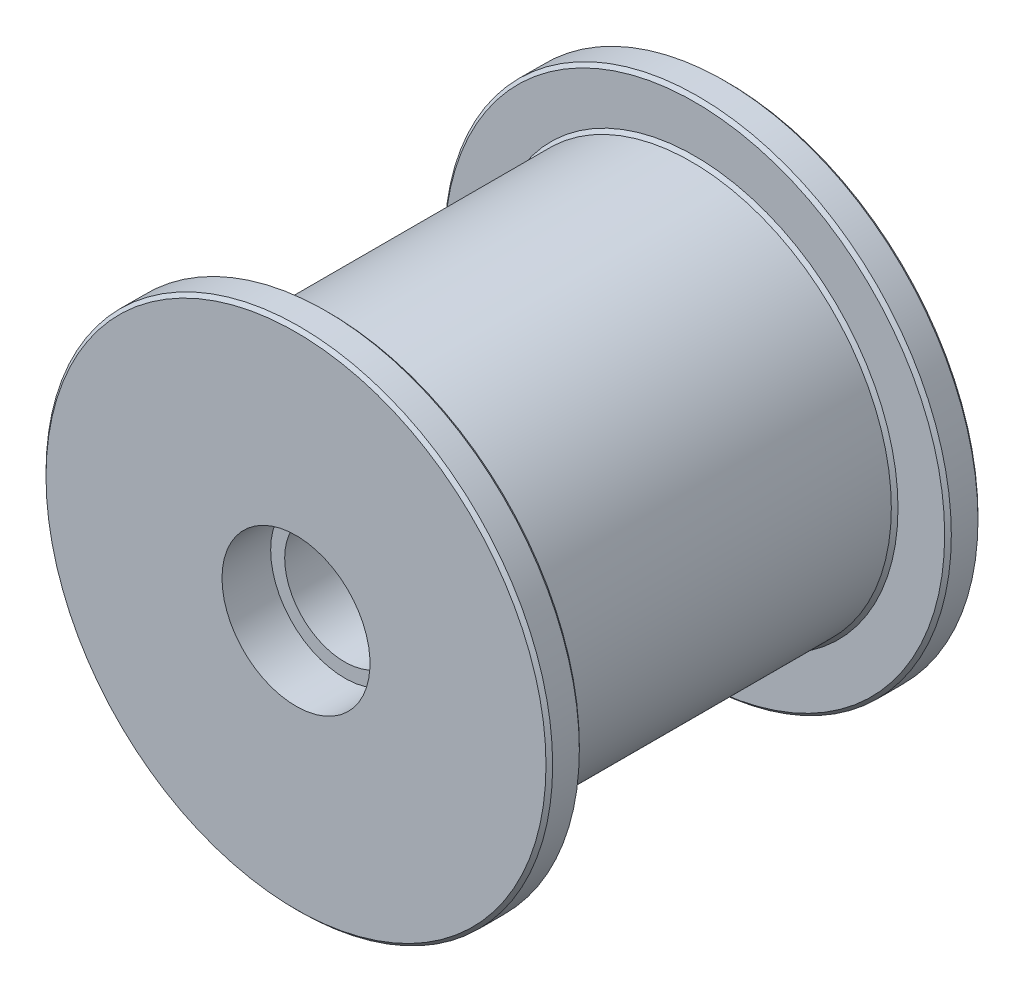
from build123d import *

# Parameters (mm, degrees)
CHAMFER1_SIZE = 0.5


with BuildPart() as part:
    # Sketch1 → Revolve1 (revolve)
    with BuildSketch(Plane(origin=(0, 0, 0), x_dir=(1, 0, 0), z_dir=(0, 1, 0))):
        Polygon((0, 0), (0, 64.8), (-38, 64.8), (-38, 59.8), (-30, 59.8), (-30, 5), (-38, 5), (-38, 0), align=None)
    revolve(axis=Axis((0, 0, 0), (0, 0, -1)))

    # Sketch7 → Cut-Revolve1 (revolve, cut)
    with BuildSketch(Plane(origin=(0, 0, 0), x_dir=(1, 0, 0), z_dir=(0, 1, 0))):
        Polygon((0, 64.8), (-11.1, 64.8), (-11.1, 57.5), (-9, 57.5), (-9, 7.3), (-11.1, 7.3), (-11.1, 0), (0, 0), align=None)
    revolve(axis=Axis((0, 0, -64.8), (0, 0, 1)), mode=Mode.SUBTRACT)

    # Chamfer1
    chamfer1_edges = [part.edges().sort_by_distance(p)[0] for p in [
        (38, 0, 0),
        (38, 0, -5),
        (30, 0, -5),
        (30, 0, -59.8),
        (38, 0, -59.8),
        (38, 0, -64.8),
    ]]
    chamfer(chamfer1_edges, length=CHAMFER1_SIZE)


solid = part.part
